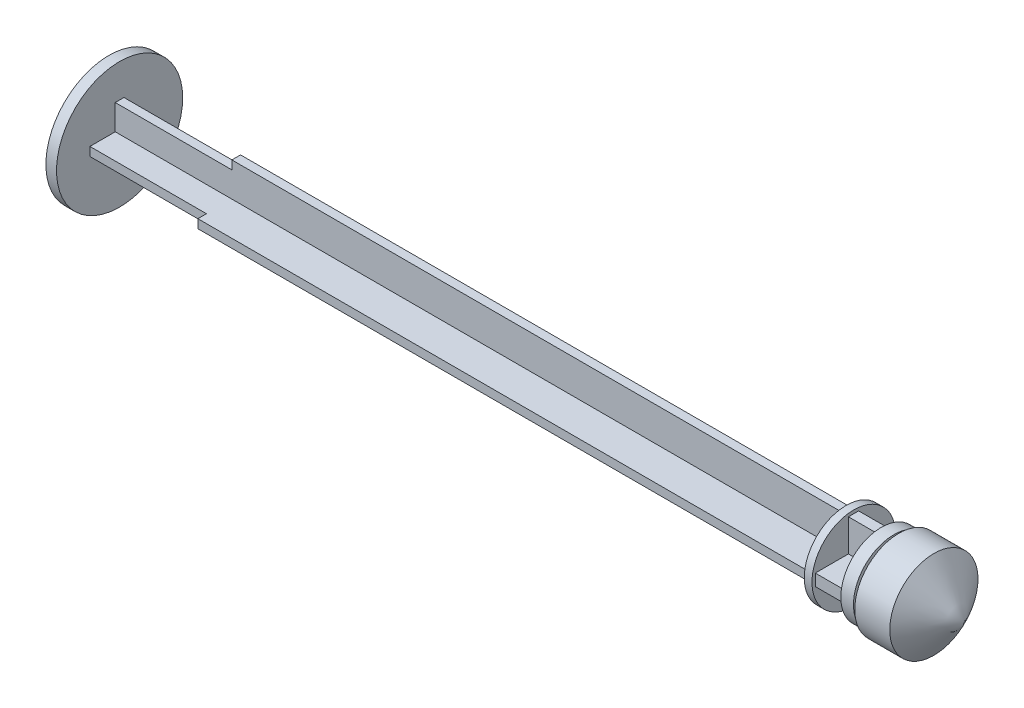
from build123d import *

# Parameters (mm, degrees)
SKETCH1_R            = 6.235
BOSS_EXTRUDE1_DEPTH  = 1.05
BOSS_EXTRUDE5_DEPTH  = 11.52
SKETCH10_W           = 0.86
SKETCH10_H           = 7.57
BOSS_EXTRUDE6_DEPTH  = 60.27
SKETCH11_W           = 7.57
SKETCH11_H           = 0.86
BOSS_EXTRUDE8_DEPTH  = 60.27
SKETCH15_R           = 4.13
BOSS_EXTRUDE9_DEPTH  = 0.76
BOSS_EXTRUDE10_DEPTH = 2.71
SKETCH17_R           = 3.99
BOSS_EXTRUDE11_DEPTH = 1.25
BOSS_EXTRUDE13_DEPTH = 0.5
SKETCH19_R           = 4.36
BOSS_EXTRUDE14_DEPTH = 3.46


with BuildPart() as part:
    # Sketch1 → Boss-Extrude1 (new body)
    with BuildSketch(Plane(origin=(0, 0, 0), x_dir=(0, 0, -1), z_dir=(1, 0, 0))):
        Circle(SKETCH1_R)
    extrude(amount=BOSS_EXTRUDE1_DEPTH)

    # Sketch2 → Boss-Extrude5 (add)
    with BuildSketch(Plane(origin=(1.05, 0, 0), x_dir=(0, 0, -1), z_dir=(1, 0, 0))):
        Polygon((-2.935, 0.43), (-2.935, -0.43), (-0.43, -0.43), (-0.43, -2.935), (0.43, -2.935), (0.43, -0.43), (2.935, -0.43), (2.935, 0.43), (0.43, 0.43), (0.43, 2.935), (-0.43, 2.935), (-0.43, 0.43), align=None)
    extrude(amount=BOSS_EXTRUDE5_DEPTH)

    # Sketch10 → Boss-Extrude6 (add)
    with BuildSketch(Plane(origin=(12.57, 0, 0), x_dir=(0, 0, -1), z_dir=(1, 0, 0))):
        Rectangle(SKETCH10_W, SKETCH10_H)
    extrude(amount=BOSS_EXTRUDE6_DEPTH)

    # Sketch11 → Boss-Extrude8 (add)
    with BuildSketch(Plane(origin=(12.57, 0, 0), x_dir=(0, 0, -1), z_dir=(1, 0, 0))):
        Rectangle(SKETCH11_W, SKETCH11_H)
    extrude(amount=BOSS_EXTRUDE8_DEPTH)

    # Sketch15 → Boss-Extrude9 (add)
    with BuildSketch(Plane(origin=(72.84, 0, 0), x_dir=(0, 0, -1), z_dir=(1, 0, 0))):
        Circle(SKETCH15_R)
    extrude(amount=BOSS_EXTRUDE9_DEPTH)

    # Sketch16 → Boss-Extrude10 (add)
    with BuildSketch(Plane(origin=(73.6, 0, 0), x_dir=(0, 0, -1), z_dir=(1, 0, 0))):
        Polygon((0.486782387, 3.8), (-0.523520681, 3.8), (-0.523520681, 0.624550988), (-3.8, 0.624550988), (-3.8, -0.532705254), (-0.523520681, -0.532705254), (-0.523520681, -3.8), (0.486782387, -3.8), (0.486782387, -0.532705254), (3.8, -0.532705254), (3.8, 0.624550988), (0.486782387, 0.624550988), align=None)
    extrude(amount=BOSS_EXTRUDE10_DEPTH)

    # Sketch17 → Boss-Extrude11 (add)
    with BuildSketch(Plane(origin=(76.31, 0, 0), x_dir=(0, 0, -1), z_dir=(1, 0, 0))):
        Circle(SKETCH17_R)
    extrude(amount=BOSS_EXTRUDE11_DEPTH)

    # Sketch18 → Boss-Extrude13 (add)
    with BuildSketch(Plane(origin=(77.56, 0, 0), x_dir=(0, 0, -1), z_dir=(1, 0, 0))):
        Polygon((0.45, 2.63), (-0.45, 2.63), (-0.45, 0.45), (-2.63, 0.45), (-2.63, -0.45), (-0.45, -0.45), (-0.45, -2.63), (0.45, -2.63), (0.45, -0.45), (2.63, -0.45), (2.63, 0.45), (0.45, 0.45), align=None)
    extrude(amount=BOSS_EXTRUDE13_DEPTH)

    # Sketch19 → Boss-Extrude14 (add)
    with BuildSketch(Plane(origin=(78.06, 0, 0), x_dir=(0, 0, -1), z_dir=(1, 0, 0))):
        Circle(SKETCH19_R)
    extrude(amount=BOSS_EXTRUDE14_DEPTH)

    # Boss-Extrude15 cone 1 section (through the dimple's axis) → Boss-Extrude15 (revolve)
    with BuildSketch(Plane(origin=(81.52, 0, 0), x_dir=(0, 0, 1), z_dir=(0, 1, 0))):
        Polygon((0, 0), (4.36, 0), (0, 3.052904867), align=None)
    revolve(axis=Axis((81.52, 0, 0), (1, 0, 0)))


solid = part.part
